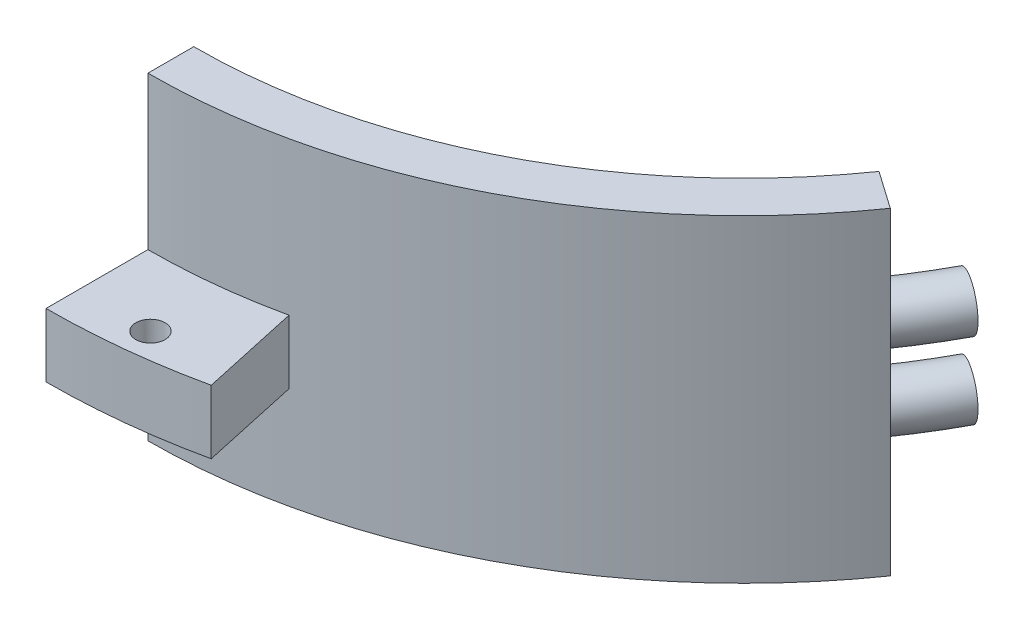
from build123d import *

# Parameters (mm, degrees)
BOSS_EXTRUDE1_DEPTH = 25
BOSS_EXTRUDE2_START = -19
BOSS_EXTRUDE2_DEPTH = 13
BOSS_EXTRUDE3_START = -17
BOSS_EXTRUDE3_DEPTH = 5
M2_HOLES_REACH      = 70.13
SKETCH5_R           = 1.15
CUT_EXTRUDE1_REACH  = 71.525
SKETCH7_R           = 2


with BuildPart() as part:
    # Sketch2 → Boss-Extrude1 (new body)
    with BuildSketch(Plane(origin=(0, 0, 0), x_dir=(1, 0, 0), z_dir=(0, 1, 0))):
        with BuildLine():
            Line((0, -43.2), (0, -46.8))
            ThreePointArc((0, -46.8), (21.609835099, -41.512106993), (38.336315673, -26.843377221))
            Line((38.336315673, -26.843377221), (35.387368313, -24.77850205))
            ThreePointArc((35.387368313, -24.77850205), (19.947540092, -38.318867993), (0, -43.2))
        make_face()
    extrude(amount=BOSS_EXTRUDE1_DEPTH)

    # Sketch3 → Boss-Extrude2 (add)
    with BuildSketch(Plane(origin=(0, 25, 0), x_dir=(1, 0, 0), z_dir=(0, 1, 0)).offset(BOSS_EXTRUDE2_START)):
        with BuildLine():
            Line((0, -40), (0, -43.2))
            ThreePointArc((0, -43.2), (19.947540092, -38.318867993), (35.387368313, -24.77850205))
            Line((35.387368313, -24.77850205), (32.766081772, -22.943057454))
            ThreePointArc((32.766081772, -22.943057454), (18.469944529, -35.480433327), (0, -40))
        make_face()
    extrude(amount=BOSS_EXTRUDE2_DEPTH)

    # Sketch4 → Boss-Extrude3 (add)
    with BuildSketch(Plane(origin=(0, 25, 0), x_dir=(1, 0, 0), z_dir=(0, 1, 0)).offset(BOSS_EXTRUDE3_START)):
        with BuildLine():
            ThreePointArc((10, -45.719142599), (5.029121512, -46.52900103), (0, -46.8))
            Line((0, -46.8), (0, -54.8))
            ThreePointArc((0, -54.8), (5.888800403, -54.482676419), (11.709401709, -53.53438065))
            Line((11.709401709, -53.53438065), (10, -45.719142599))
        make_face()
    extrude(amount=BOSS_EXTRUDE3_DEPTH)

    # Sketch5 → M2 holes (cut, up to next)
    with BuildSketch(Plane(origin=(0, 13, 0), x_dir=(1, 0, 0), z_dir=(0, 1, 0)), mode=Mode.PRIVATE) as m2_holes_sk1:
        with Locations((5.647015715, -52.245705216)):
            Circle(SKETCH5_R)
    m2_holes_tool1 = extrude(m2_holes_sk1.sketch, amount=-M2_HOLES_REACH, mode=Mode.PRIVATE) & part.part
    add(m2_holes_tool1.solids().sort_by_distance((5.647016, 13, 52.245705))[0], mode=Mode.SUBTRACT)

    # Sketch6 → Cut-Extrude1 (cut, up to next)
    with BuildSketch(Plane(origin=(0, 19, 0), x_dir=(1, 0, 0), z_dir=(0, 1, 0)), mode=Mode.PRIVATE) as cut_extrude1_sk1:
        with BuildLine():
            Line((0, -40), (0, -43))
            Line((0, -43), (5, -39.686269666))
            ThreePointArc((5, -39.686269666), (2.504916502, -39.921490369), (0, -40))
        make_face()
    cut_extrude1_tool1 = extrude(cut_extrude1_sk1.sketch, amount=-CUT_EXTRUDE1_REACH, mode=Mode.PRIVATE) & part.part
    add(cut_extrude1_tool1.solids().sort_by_distance((1.636399, 19, 40.932418))[0], mode=Mode.SUBTRACT)

    # Sweep1: sweep along a path in Sketch9
    with BuildLine(Plane(origin=(0, 25, 0), x_dir=(1, 0, 0), z_dir=(0, 1, 0))) as sweep1_path:
        ThreePointArc((35.387368313, -24.77850205), (36.762003919, -22.689095792), (38.013421067, -20.523640486))
    # Sketch7 → Sweep1 (sweep)
    with BuildSketch(Plane(origin=(0, 0, 0), x_dir=(-0.8191520442889931, 0, -0.5735764363510442), z_dir=(0.5735764363510442, 0, -0.8191520442889931))):
        with Locations((-43.4, 15.5)):
            Circle(SKETCH7_R)
        with Locations((-43.4, 9.5)):
            Circle(SKETCH7_R)
    sweep(path=sweep1_path.line)


solid = part.part
